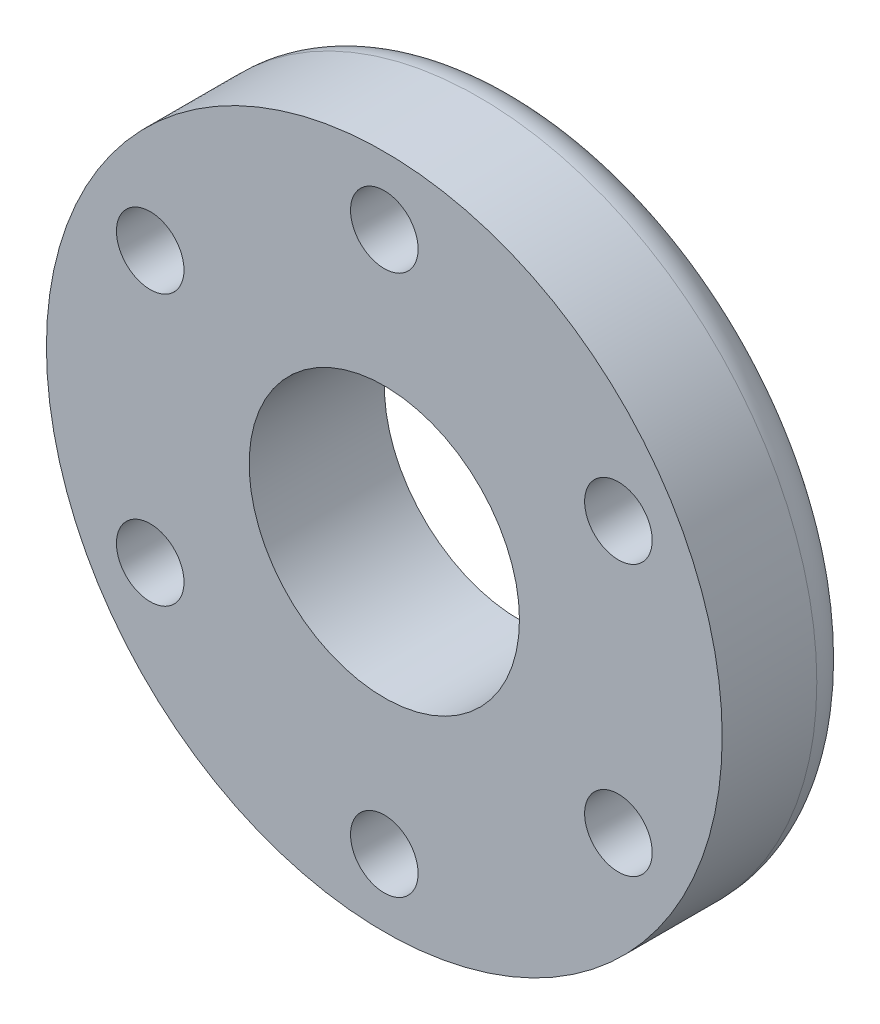
from build123d import *

# Parameters (mm, degrees)
SKETCH1_R           = 25
SKETCH1_R_2         = 10
BOSS_EXTRUDE1_DEPTH = 10
SKETCH2_R           = 2.5
CUT_EXTRUDE1_DEPTH  = 10
FILLET1_R           = 3


with BuildPart() as part:
    # Sketch1 → Boss-Extrude1 (new body)
    with BuildSketch(Plane.XY):
        Circle(SKETCH1_R)
        Circle(SKETCH1_R_2, mode=Mode.SUBTRACT)
    extrude(amount=BOSS_EXTRUDE1_DEPTH)

    # Sketch2 → Cut-Extrude1 (cut)
    with BuildSketch(Plane.XY.offset(10)):
        with Locations((0, 20)):
            Circle(SKETCH2_R)
        with Locations((17.320508076, 10)):
            Circle(SKETCH2_R)
        with Locations((17.320508076, -10)):
            Circle(SKETCH2_R)
        with Locations((0, -20)):
            Circle(SKETCH2_R)
        with Locations((-17.320508076, -10)):
            Circle(SKETCH2_R)
        with Locations((-17.320508076, 10)):
            Circle(SKETCH2_R)
    extrude(amount=-CUT_EXTRUDE1_DEPTH, mode=Mode.SUBTRACT)

    # Fillet1
    # the kernel refuses this fillet: 3 mm, written as the material it takes off along each edge
    with BuildSketch(Plane(origin=(0, 0, 0), x_dir=(1, 0, 0), z_dir=(0, -1, 0))) as fillet1_piece_1:
        with BuildLine():
            CenterArc((25 - FILLET1_R, FILLET1_R), FILLET1_R, 270, 90)
            Line((25 - FILLET1_R, 0), (25, 0))
            Line((25, 0), (25, FILLET1_R))
        make_face()
    revolve(axis=Axis((0, 0, 0), (0, 0, 1)), mode=Mode.SUBTRACT)


solid = part.part
